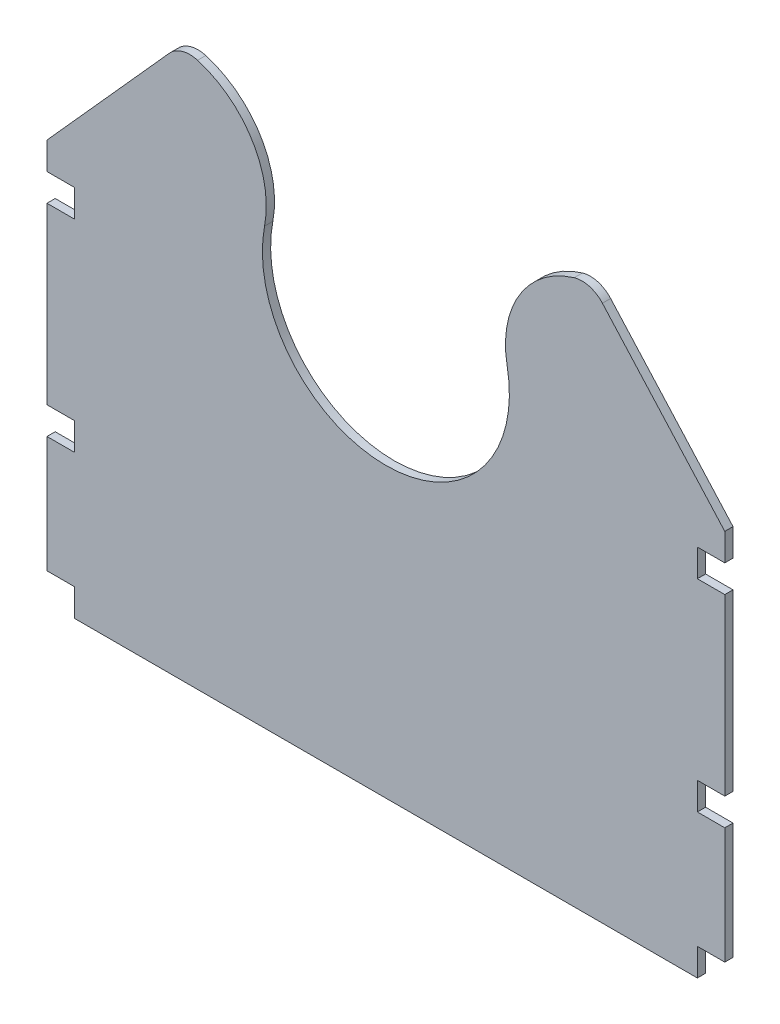
from build123d import *

# Parameters (mm, degrees)
BOSS_EXTRU_1_DEPTH      = 3
ENL_V_MAT_EXTRU_1_DEPTH = 345.268848431
ESQUISSE4_W             = 10
ESQUISSE4_H             = 10
ENL_V_MAT_EXTRU_2_DEPTH = 331.898715622
ENL_V_MAT_EXTRU_3_DEPTH = 331.898715622
CONG_2_R                = 10


with BuildPart() as part:
    # Esquisse1 → Boss.-Extru.1 (new body)
    with BuildSketch(Plane.XY):
        Polygon((0, 0), (0, 127.45), (65.1, 200), (215.1, 200), (280.2, 127.45), (280.2, 0), align=None)
    extrude(amount=BOSS_EXTRU_1_DEPTH)

    # Esquisse2 → Enlèv. mat.-Extru.1 (cut, through all)
    with BuildSketch(Plane(origin=(0, 0, 0), x_dir=(-1, 0, 0), z_dir=(0, 0, -1))):
        Polygon((-16.6, 0), (-16.6, 145.969439351), (0, 127.45), (0, 0), align=None)
        Polygon((-280.2, 127.45), (-263.6, 145.969439351), (-263.6, 0), (-280.2, 0), align=None)
    extrude(amount=-ENL_V_MAT_EXTRU_1_DEPTH, mode=Mode.SUBTRACT)

    # Esquisse4 → Enlèv. mat.-Extru.2 (cut, through all)
    with BuildSketch(Plane.XY.offset(3)):
        with Locations((21.6, 5)):
            Rectangle(ESQUISSE4_W, ESQUISSE4_H)
        with Locations((21.6, 57.4)):
            Rectangle(ESQUISSE4_W, ESQUISSE4_H)
        with Locations((258.6, 131)):
            Rectangle(ESQUISSE4_W, ESQUISSE4_H)
        with Locations((21.6, 131)):
            Rectangle(ESQUISSE4_W, ESQUISSE4_H)
        with Locations((258.6, 57.4)):
            Rectangle(ESQUISSE4_W, ESQUISSE4_H)
        with Locations((258.6, 5)):
            Rectangle(ESQUISSE4_W, ESQUISSE4_H)
    extrude(amount=-ENL_V_MAT_EXTRU_2_DEPTH, mode=Mode.SUBTRACT)

    # Esquisse5 → Enlèv. mat.-Extru.3 (cut, through all)
    with BuildSketch(Plane.XY.offset(3)):
        with BuildLine():
            ThreePointArc((184.301907128, 158.4375), (191.711856965, 187.308210372), (218.681168228, 200))
            Line((218.681168228, 200), (215.1, 200))
            Line((215.1, 200), (140.1, 200))
            Line((140.1, 200), (65.1, 200))
            Line((65.1, 200), (61.518831772, 200))
            ThreePointArc((61.518831772, 200), (88.488143035, 187.308210372), (95.898092872, 158.4375))
            ThreePointArc((95.898092872, 158.4375), (140.1, 105), (184.301907128, 158.4375))
        make_face()
    extrude(amount=-ENL_V_MAT_EXTRU_3_DEPTH, mode=Mode.SUBTRACT)

    # Congé2
    cong_2_edges = [part.edges().sort_by_distance(p)[0] for p in [
        (64.94882545, 199.831525137, 1.5),
        (215.25117455, 199.831525137, 1.5),
    ]]
    fillet(cong_2_edges, radius=CONG_2_R)


solid = part.part
